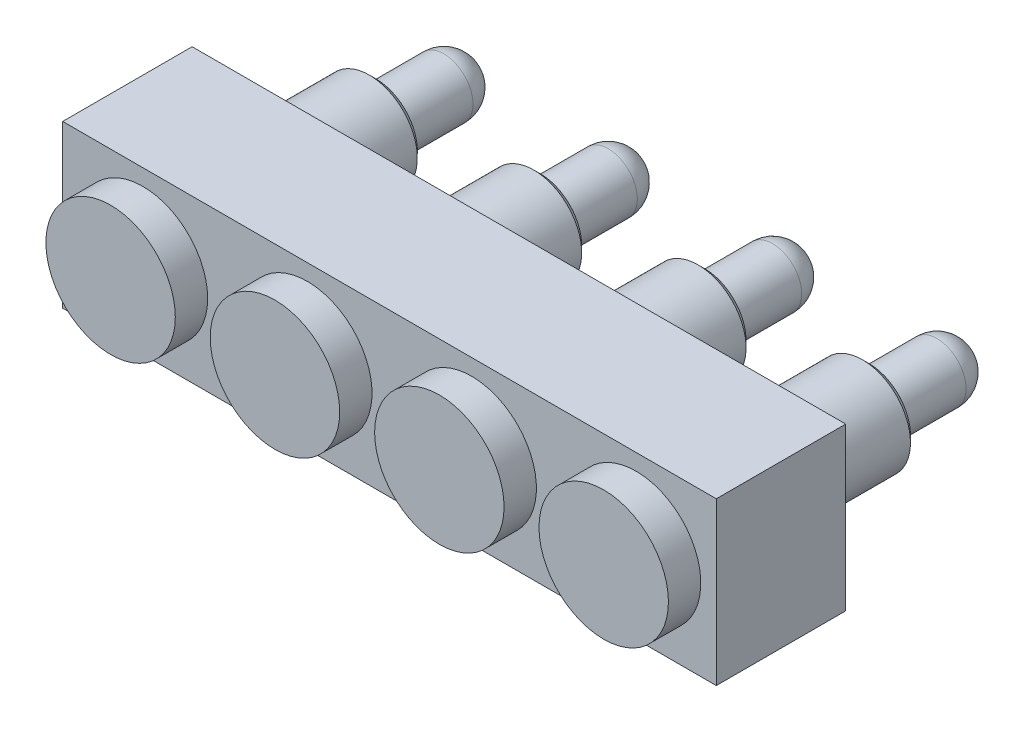
from build123d import *

# Parameters (mm, degrees)
SKETCH_1_W        = 10.1
SKETCH_1_H        = 2.5
SKETCH_1_R        = 0.74
EXTRUDE_1_DEPTH   = 2
SKETCH_2_R        = 1
EXTRUDE_2_DEPTH   = 0.5
SKETCH_3_R        = 0.74
EXTRUDE_3_DEPTH   = 1.6
EXTRUDE_3_2_DEPTH = 1.6
EXTRUDE_3_3_DEPTH = 1.6
EXTRUDE_3_4_DEPTH = 1.6
SKETCH_4_R        = 0.45
EXTRUDE_4_DEPTH   = 3.1
FILLET_1_R        = 0.45
FILLET_2_R        = 0.45
FILLET_3_R        = 0.45
FILLET_4_R        = 0.45
CHAMFER_1_SIZE    = 0.1
CHAMFER_2_SIZE    = 0.1
CHAMFER_3_SIZE    = 0.1
CHAMFER_4_SIZE    = 0.1


with BuildPart() as part:
    # 草图1 → 凸台-拉伸1 (new body)
    with BuildSketch(Plane.XY):
        with Locations((5.05405893, 1.252481567)):
            Rectangle(SKETCH_1_W, SKETCH_1_H)
        with Locations((3.78405893, 1.252481567)):
            Circle(SKETCH_1_R, mode=Mode.SUBTRACT)
        with Locations((1.24405893, 1.252481567)):
            Circle(SKETCH_1_R, mode=Mode.SUBTRACT)
        with Locations((8.86405893, 1.252481567)):
            Circle(SKETCH_1_R, mode=Mode.SUBTRACT)
        with Locations((6.32405893, 1.252481567)):
            Circle(SKETCH_1_R, mode=Mode.SUBTRACT)
    extrude(amount=EXTRUDE_1_DEPTH)

    # 草图2 → 凸台-拉伸2 (add)
    with BuildSketch(Plane.XY.offset(2)):
        with Locations((1.24405893, 1.252481567)):
            Circle(SKETCH_2_R)
        with Locations((3.78405893, 1.252481567)):
            Circle(SKETCH_2_R)
        with Locations((6.32405893, 1.252481567)):
            Circle(SKETCH_2_R)
        with Locations((8.86405893, 1.252481567)):
            Circle(SKETCH_2_R)
    extrude(amount=EXTRUDE_2_DEPTH)


with BuildPart() as body_2:
    # 草图3 → 凸台-拉伸3 (new body)
    with BuildSketch(Plane(origin=(0, 0, 0), x_dir=(-1, 0, 0), z_dir=(0, 0, -1))):
        with Locations((-1.24405893, 1.252481567)):
            Circle(SKETCH_3_R)
    extrude(amount=EXTRUDE_3_DEPTH)



with BuildPart() as body_3:
    # 草图3 → Extrude 3 2 (new body)
    with BuildSketch(Plane(origin=(0, 0, 0), x_dir=(-1, 0, 0), z_dir=(0, 0, -1))):
        with Locations((-3.78405893, 1.252481567)):
            Circle(SKETCH_3_R)
    extrude(amount=EXTRUDE_3_2_DEPTH)


with BuildPart() as body_4:
    # 草图3 → Extrude 3 3 (new body)
    with BuildSketch(Plane(origin=(0, 0, 0), x_dir=(-1, 0, 0), z_dir=(0, 0, -1))):
        with Locations((-6.32405893, 1.252481567)):
            Circle(SKETCH_3_R)
    extrude(amount=EXTRUDE_3_3_DEPTH)


with BuildPart() as body_5:
    # 草图3 → Extrude 3 4 (new body)
    with BuildSketch(Plane(origin=(0, 0, 0), x_dir=(-1, 0, 0), z_dir=(0, 0, -1))):
        with Locations((-8.86405893, 1.252481567)):
            Circle(SKETCH_3_R)
    extrude(amount=EXTRUDE_3_4_DEPTH)


with BuildPart() as body_2_1:
    add(body_2.part)

    add(body_3.part)  # 凸台-拉伸4 merges body 3

    add(body_4.part)  # 凸台-拉伸4 merges body 4

    add(body_5.part)  # 凸台-拉伸4 merges body 5
    # 草图4 → 凸台-拉伸4 (add)
    with BuildSketch(Plane(origin=(0, 0, 0), x_dir=(-1, 0, 0), z_dir=(0, 0, -1))):
        with Locations((-8.86405893, 1.252481567)):
            Circle(SKETCH_4_R)
        with Locations((-6.32405893, 1.252481567)):
            Circle(SKETCH_4_R)
        with Locations((-3.78405893, 1.252481567)):
            Circle(SKETCH_4_R)
        with Locations((-1.24405893, 1.252481567)):
            Circle(SKETCH_4_R)
    extrude(amount=EXTRUDE_4_DEPTH)

    # 圆角1
    fillet_1_edges = [body_2_1.edges().sort_by_distance(p)[0] for p in [
        (9.31405893, 1.252481567, -3.1),
    ]]
    fillet(fillet_1_edges, radius=FILLET_1_R)

    # 圆角2
    fillet_2_edges = [body_2_1.edges().sort_by_distance(p)[0] for p in [
        (6.77405893, 1.252481567, -3.1),
    ]]
    fillet(fillet_2_edges, radius=FILLET_2_R)

    # 圆角3
    fillet_3_edges = [body_2_1.edges().sort_by_distance(p)[0] for p in [
        (4.23405893, 1.252481567, -3.1),
    ]]
    fillet(fillet_3_edges, radius=FILLET_3_R)

    # 圆角4
    fillet_4_edges = [body_2_1.edges().sort_by_distance(p)[0] for p in [
        (1.69405893, 1.252481567, -3.1),
    ]]
    fillet(fillet_4_edges, radius=FILLET_4_R)

    # 倒角1
    chamfer_1_edges = [body_2_1.edges().sort_by_distance(p)[0] for p in [
        (9.60405893, 1.252481567, -1.6),
    ]]
    chamfer(chamfer_1_edges, length=CHAMFER_1_SIZE)

    # 倒角2
    chamfer_2_edges = [body_2_1.edges().sort_by_distance(p)[0] for p in [
        (7.06405893, 1.252481567, -1.6),
    ]]
    chamfer(chamfer_2_edges, length=CHAMFER_2_SIZE)

    # 倒角3
    chamfer_3_edges = [body_2_1.edges().sort_by_distance(p)[0] for p in [
        (4.52405893, 1.252481567, -1.6),
    ]]
    chamfer(chamfer_3_edges, length=CHAMFER_3_SIZE)

    # 倒角4
    chamfer_4_edges = [body_2_1.edges().sort_by_distance(p)[0] for p in [
        (1.98405893, 1.252481567, -1.6),
    ]]
    chamfer(chamfer_4_edges, length=CHAMFER_4_SIZE)


solid = Compound([part.part, body_2_1.part])
